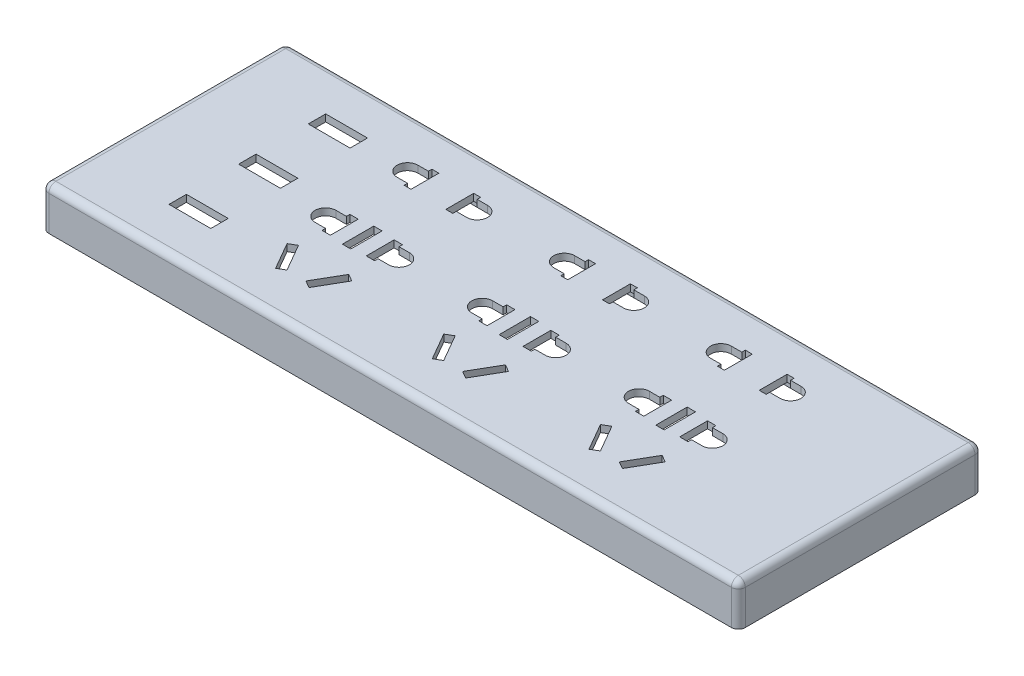
from build123d import *

# Parameters (mm, degrees)
RECTANGLEBOX_DEPTH      = 2
RECTANGLEBOX_DEPTH_BACK = 10
SKETCHREC_W             = 200
SKETCHREC_H             = 70
RECTANGLER_R            = 2
RECTANGLEC_START        = -98
RECTANGLEC_OUTLINE_W    = 10
RECTANGLEC_OUTLINE_H    = 66
RECTANGLEC_DEPTH        = 196
SSLOTA_W                = 2.4
SSLOTA_H                = 9
FSLOTACUT_DEPTH         = 107.625512894
SSLOTA2_W               = 2.4
SSLOTA2_H               = 9
FSLOTA2CUT_DEPTH        = 107.625512894
SSLOTA3_W               = 2.4
SSLOTA3_H               = 9
FSLOTA3CUT_DEPTH        = 107.625512894
FSLOTBCUT_DEPTH         = 107.625512894
FSLOTB2CUT_DEPTH        = 107.625512894
FSLOTB3CUT_DEPTH        = 107.625512894
SSLOTC_W                = 12
SSLOTC_H                = 5
FSLOTCCUT_DEPTH         = 107.625512894
SSLOTC2_W               = 12
SSLOTC2_H               = 5
FSLOTC2CUT_DEPTH        = 107.625512894
SSLOTC3_W               = 12
SSLOTC3_H               = 5
FSLOTC3CUT_DEPTH        = 107.625512894


# Read off the part's stored shape, not the designer's step: RectangleC
with BuildPart() as part:
    # SketchRec → RectangleBox (new, two sides: drawn at the far end of the back side and taken through both)
    with BuildSketch(Plane(origin=(0, 0, 0), x_dir=(1, 0, 0), z_dir=(0, 1, 0)).offset(-RECTANGLEBOX_DEPTH_BACK)):
        Rectangle(SKETCHREC_W, SKETCHREC_H)
    extrude(amount=RECTANGLEBOX_DEPTH + RECTANGLEBOX_DEPTH_BACK)

    # RectangleR
    rectangler_edges = [part.edges().sort_by_distance(p)[0] for p in [
        (100, 2, 0),
        (0, 2, -35),
        (-100, 2, 0),
        (0, 2, 35),
        (100, -4, 35),
        (-100, -4, 35),
        (-100, -4, -35),
        (100, -4, -35),
    ]]
    fillet(rectangler_edges, radius=RECTANGLER_R)

    # RectangleC outline → RectangleC (cut)
    with BuildSketch(Plane.YZ.offset(RECTANGLEC_START)):
        with Locations((-5, 0)):
            Rectangle(RECTANGLEC_OUTLINE_W, RECTANGLEC_OUTLINE_H)
    extrude(amount=RECTANGLEC_DEPTH, mode=Mode.SUBTRACT)

    # SSlotA → FSlotACut (cut, through all)
    with BuildSketch(Plane(origin=(0, -10, 0), x_dir=(1, 0, 0), z_dir=(0, 1, 0))):
        with BuildLine():
            Line((-45.15, -7), (-45.15, 1))
            Line((-45.15, 1), (-47.55, 1))
            Line((-47.55, 1), (-47.55, 0))
            Line((-47.55, 0), (-50.55, 0))
            ThreePointArc((-50.55, 0), (-53.55, -3), (-50.55, -6))
            Line((-50.55, -6), (-47.55, -6))
            Line((-47.55, -6), (-47.55, -7))
            Line((-47.55, -7), (-45.15, -7))
        make_face()
        with Locations((-40, -3)):
            Rectangle(SSLOTA_W, SSLOTA_H)
        with BuildLine():
            Line((-32.45, 0), (-32.45, 1))
            Line((-32.45, 1), (-34.85, 1))
            Line((-34.85, 1), (-34.85, -7))
            Line((-34.85, -7), (-32.45, -7))
            Line((-32.45, -7), (-32.45, -6))
            Line((-32.45, -6), (-29.45, -6))
            ThreePointArc((-29.45, -6), (-26.45, -3), (-29.45, 0))
            Line((-29.45, 0), (-32.45, 0))
        make_face()
        Polygon((-37.283121635, -21.894228634), (-35.204660666, -23.094228634), (-30.704660666, -15.3), (-32.783121635, -14.1), align=None)
        Polygon((-49.295339334, -15.3), (-44.795339334, -23.094228634), (-42.716878365, -21.894228634), (-47.216878365, -14.1), align=None)
    extrude(amount=FSLOTACUT_DEPTH, mode=Mode.SUBTRACT)

    # SSlotA2 → FSlotA2Cut (cut, through all)
    with BuildSketch(Plane(origin=(0, -10, 0), x_dir=(1, 0, 0), z_dir=(0, 1, 0))):
        with BuildLine():
            Line((-0.15, -7), (-0.15, 1))
            Line((-0.15, 1), (-2.55, 1))
            Line((-2.55, 1), (-2.55, 0))
            Line((-2.55, 0), (-5.55, 0))
            ThreePointArc((-5.55, 0), (-8.55, -3), (-5.55, -6))
            Line((-5.55, -6), (-2.55, -6))
            Line((-2.55, -6), (-2.55, -7))
            Line((-2.55, -7), (-0.15, -7))
        make_face()
        with Locations((5, -3)):
            Rectangle(SSLOTA2_W, SSLOTA2_H)
        with BuildLine():
            Line((12.55, 0), (12.55, 1))
            Line((12.55, 1), (10.15, 1))
            Line((10.15, 1), (10.15, -7))
            Line((10.15, -7), (12.55, -7))
            Line((12.55, -7), (12.55, -6))
            Line((12.55, -6), (15.55, -6))
            ThreePointArc((15.55, -6), (18.55, -3), (15.55, 0))
            Line((15.55, 0), (12.55, 0))
        make_face()
        Polygon((7.716878365, -21.894228634), (9.795339334, -23.094228634), (14.295339334, -15.3), (12.216878365, -14.1), align=None)
        Polygon((-4.295339334, -15.3), (0.204660666, -23.094228634), (2.283121635, -21.894228634), (-2.216878365, -14.1), align=None)
    extrude(amount=FSLOTA2CUT_DEPTH, mode=Mode.SUBTRACT)

    # SSlotA3 → FSlotA3Cut (cut, through all)
    with BuildSketch(Plane(origin=(0, -10, 0), x_dir=(1, 0, 0), z_dir=(0, 1, 0))):
        with BuildLine():
            Line((44.85, -7), (44.85, 1))
            Line((44.85, 1), (42.45, 1))
            Line((42.45, 1), (42.45, 0))
            Line((42.45, 0), (39.45, 0))
            ThreePointArc((39.45, 0), (36.45, -3), (39.45, -6))
            Line((39.45, -6), (42.45, -6))
            Line((42.45, -6), (42.45, -7))
            Line((42.45, -7), (44.85, -7))
        make_face()
        with Locations((50, -3)):
            Rectangle(SSLOTA3_W, SSLOTA3_H)
        with BuildLine():
            Line((57.55, 0), (57.55, 1))
            Line((57.55, 1), (55.15, 1))
            Line((55.15, 1), (55.15, -7))
            Line((55.15, -7), (57.55, -7))
            Line((57.55, -7), (57.55, -6))
            Line((57.55, -6), (60.55, -6))
            ThreePointArc((60.55, -6), (63.55, -3), (60.55, 0))
            Line((60.55, 0), (57.55, 0))
        make_face()
        Polygon((52.716878365, -21.894228634), (54.795339334, -23.094228634), (59.295339334, -15.3), (57.216878365, -14.1), align=None)
        Polygon((40.704660666, -15.3), (45.204660666, -23.094228634), (47.283121635, -21.894228634), (42.783121635, -14.1), align=None)
    extrude(amount=FSLOTA3CUT_DEPTH, mode=Mode.SUBTRACT)

    # SSlotB → FSlotBCut (cut, through all)
    with BuildSketch(Plane(origin=(0, -10, 0), x_dir=(1, 0, 0), z_dir=(0, 1, 0))):
        with BuildLine():
            Line((-45, 16), (-45, 24))
            Line((-45, 24), (-47, 24))
            Line((-47, 24), (-47, 23))
            Line((-47, 23), (-50, 23))
            ThreePointArc((-50, 23), (-53, 20), (-50, 17))
            Line((-50, 17), (-47, 17))
            Line((-47, 17), (-47, 16))
            Line((-47, 16), (-45, 16))
        make_face()
        with BuildLine():
            Line((-33, 17), (-30, 17))
            ThreePointArc((-30, 17), (-27, 20), (-30, 23))
            Line((-30, 23), (-33, 23))
            Line((-33, 23), (-33, 24))
            Line((-33, 24), (-35, 24))
            Line((-35, 24), (-35, 16))
            Line((-35, 16), (-33, 16))
            Line((-33, 16), (-33, 17))
        make_face()
    extrude(amount=FSLOTBCUT_DEPTH, mode=Mode.SUBTRACT)

    # SSlotB2 → FSlotB2Cut (cut, through all)
    with BuildSketch(Plane(origin=(0, -10, 0), x_dir=(1, 0, 0), z_dir=(0, 1, 0))):
        with BuildLine():
            Line((0, 16), (0, 24))
            Line((0, 24), (-2, 24))
            Line((-2, 24), (-2, 23))
            Line((-2, 23), (-5, 23))
            ThreePointArc((-5, 23), (-8, 20), (-5, 17))
            Line((-5, 17), (-2, 17))
            Line((-2, 17), (-2, 16))
            Line((-2, 16), (0, 16))
        make_face()
        with BuildLine():
            Line((12, 17), (15, 17))
            ThreePointArc((15, 17), (18, 20), (15, 23))
            Line((15, 23), (12, 23))
            Line((12, 23), (12, 24))
            Line((12, 24), (10, 24))
            Line((10, 24), (10, 16))
            Line((10, 16), (12, 16))
            Line((12, 16), (12, 17))
        make_face()
    extrude(amount=FSLOTB2CUT_DEPTH, mode=Mode.SUBTRACT)

    # SSlotB3 → FSlotB3Cut (cut, through all)
    with BuildSketch(Plane(origin=(0, -10, 0), x_dir=(1, 0, 0), z_dir=(0, 1, 0))):
        with BuildLine():
            Line((45, 16), (45, 24))
            Line((45, 24), (43, 24))
            Line((43, 24), (43, 23))
            Line((43, 23), (40, 23))
            ThreePointArc((40, 23), (37, 20), (40, 17))
            Line((40, 17), (43, 17))
            Line((43, 17), (43, 16))
            Line((43, 16), (45, 16))
        make_face()
        with BuildLine():
            Line((57, 17), (60, 17))
            ThreePointArc((60, 17), (63, 20), (60, 23))
            Line((60, 23), (57, 23))
            Line((57, 23), (57, 24))
            Line((57, 24), (55, 24))
            Line((55, 24), (55, 16))
            Line((55, 16), (57, 16))
            Line((57, 16), (57, 17))
        make_face()
    extrude(amount=FSLOTB3CUT_DEPTH, mode=Mode.SUBTRACT)

    # SSlotC → FSlotCCut (cut, through all)
    with BuildSketch(Plane(origin=(0, -10, 0), x_dir=(1, 0, 0), z_dir=(0, 1, 0))):
        with Locations((-70, 20)):
            Rectangle(SSLOTC_W, SSLOTC_H)
    extrude(amount=FSLOTCCUT_DEPTH, mode=Mode.SUBTRACT)

    # SSlotC2 → FSlotC2Cut (cut, through all)
    with BuildSketch(Plane(origin=(0, -10, 0), x_dir=(1, 0, 0), z_dir=(0, 1, 0))):
        with Locations((-70, 0)):
            Rectangle(SSLOTC2_W, SSLOTC2_H)
    extrude(amount=FSLOTC2CUT_DEPTH, mode=Mode.SUBTRACT)

    # SSlotC3 → FSlotC3Cut (cut, through all)
    with BuildSketch(Plane(origin=(0, -10, 0), x_dir=(1, 0, 0), z_dir=(0, 1, 0))):
        with Locations((-70, -20)):
            Rectangle(SSLOTC3_W, SSLOTC3_H)
    extrude(amount=FSLOTC3CUT_DEPTH, mode=Mode.SUBTRACT)


solid = part.part
